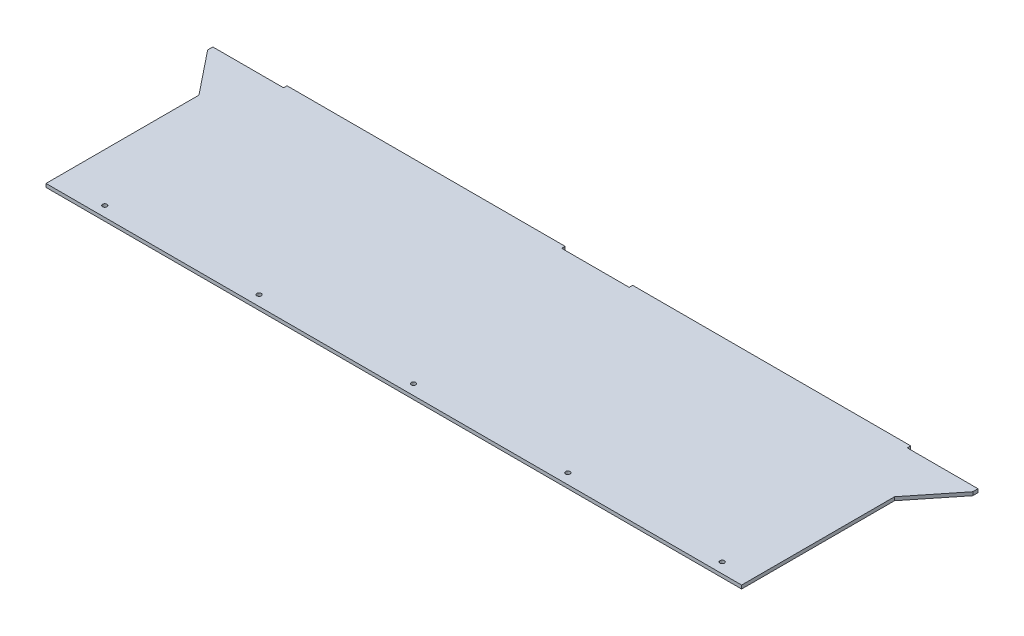
from build123d import *

# Parameters (mm, degrees)
SKETCH1_W           = 635.3556
SKETCH1_H           = 184.15
BOSS_EXTRUDE1_DEPTH = 1.5875
SKETCH2_W           = 254
SKETCH2_H           = 3.175
BOSS_EXTRUDE2_DEPTH = 3.175
BOSS_EXTRUDE3_DEPTH = 3.175
SKETCH4_R           = 2.025
CUT_EXTRUDE1_DEPTH  = 10
LPATTERN1_COUNT     = 5
LPATTERN1_PITCH     = 140.97


with BuildPart() as part:
    # Sketch1 → Boss-Extrude1 (new, symmetric)
    with BuildSketch(Plane(origin=(0, 0, 0), x_dir=(1, 0, 0), z_dir=(0, 1, 0))):
        Rectangle(SKETCH1_W, SKETCH1_H)
    extrude(amount=BOSS_EXTRUDE1_DEPTH, both=True)

    # Sketch2 → Boss-Extrude2 (add)
    with BuildSketch(Plane(origin=(0, 0, -92.075), x_dir=(-1, 0, 0), z_dir=(0, 0, -1))):
        with Locations((-157.8229, 0)):
            Rectangle(SKETCH2_W, SKETCH2_H)
        with Locations((157.8229, 0)):
            Rectangle(SKETCH2_W, SKETCH2_H)
    extrude(amount=BOSS_EXTRUDE2_DEPTH)

    # Sketch3 → Boss-Extrude3 (add)
    with BuildSketch(Plane.XZ.offset(1.5875)):
        Polygon((317.6778, -92.075), (349.4278, -92.075), (349.4278, -87.3125), (317.6778, -47.625), align=None)
    boss_extrude3 = extrude(amount=-BOSS_EXTRUDE3_DEPTH)

    # Mirror1: Boss-Extrude3 across plane
    add(boss_extrude3.mirror(Plane(origin=(0, 0, 0), x_dir=(0, 0, 1), z_dir=(1, 0, 0))))

    # Sketch4 → Cut-Extrude1 (cut)
    with BuildSketch(Plane(origin=(0, 1.5875, 0), x_dir=(1, 0, 0), z_dir=(0, 1, 0))):
        with Locations((290.4998, -82.677)):
            Circle(SKETCH4_R)
    cut_extrude1 = extrude(amount=-CUT_EXTRUDE1_DEPTH, mode=Mode.SUBTRACT)

    # LPattern1: Cut-Extrude1 ×5
    with Locations(*[(-i * LPATTERN1_PITCH, 0, 0) for i in range(1, LPATTERN1_COUNT)]):
        add(cut_extrude1, mode=Mode.SUBTRACT)


solid = part.part
